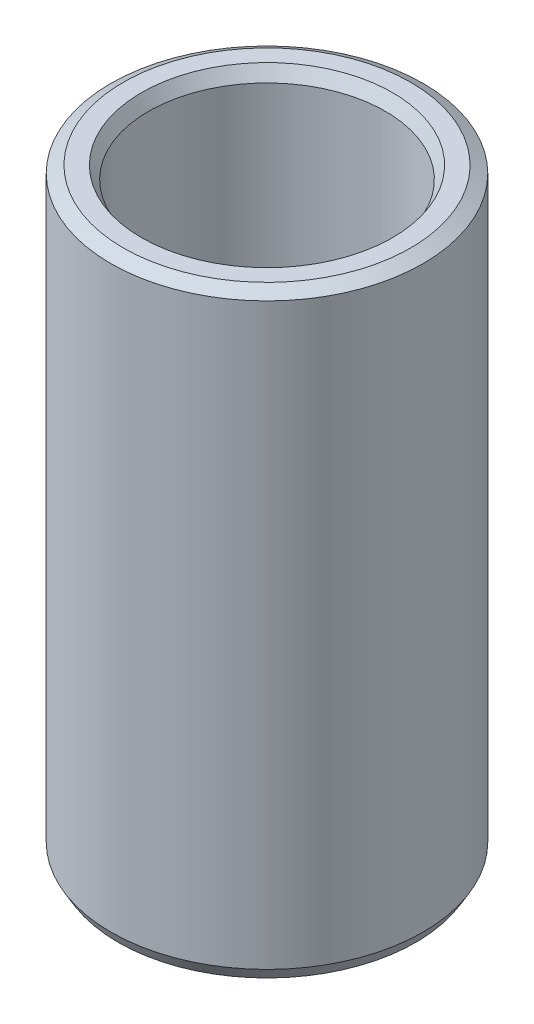
from build123d import *
from OCP.BRepFilletAPI import BRepFilletAPI_MakeChamfer

# Parameters (mm, degrees)
SKETCH1_R           = 12.5
BOSS_EXTRUDE1_DEPTH = 47.932570615
SKETCH2_R           = 9.47765929
CUT_EXTRUDE1_DEPTH  = 52.088465682
CHAMFER1_SIZE       = 0.579074246
CHAMFER1_SIZE2      = 1.002986016


with BuildPart() as part:
    # Sketch1 → Boss-Extrude1 (new body)
    with BuildSketch(Plane(origin=(0, 0, 0), x_dir=(1, 0, 0), z_dir=(0, 1, 0))):
        Circle(SKETCH1_R)
    extrude(amount=BOSS_EXTRUDE1_DEPTH)

    # Sketch2 → Cut-Extrude1 (cut, through all)
    with BuildSketch(Plane(origin=(0, 0, 0), x_dir=(1, 0, 0), z_dir=(0, 1, 0))):
        Circle(SKETCH2_R)
    extrude(amount=CUT_EXTRUDE1_DEPTH, mode=Mode.SUBTRACT)

    # Chamfer1: one chamfer whose edges measure the first distance from different faces: ONE call of the kernel's chamfer builder (chamfer() names one face for all edges)
    chamfer1_edges_1 = [part.edges().sort_by_distance(p)[0] for p in [
        (-9.47765929, 47.932570615, 0),
    ]]
    chamfer1_side_1 = [part.faces().sort_by_distance(p)[0] for p in [
        (-12.146446609, 47.932570615, 0),
    ]]
    chamfer1_edges_2 = [part.edges().sort_by_distance(p)[0] for p in [
        (-9.47765929, 0, 0),
    ]]
    chamfer1_side_2 = [part.faces().sort_by_distance(p)[0] for p in [
        (-9.47765929, 23.966285308, 0),
    ]]
    chamfer1_edges_3 = [part.edges().sort_by_distance(p)[0] for p in [
        (-12.5, 0, 0),
    ]]
    chamfer1_side_3 = [part.faces().sort_by_distance(p)[0] for p in [
        (-12.146446609, 0, 0),
    ]]
    chamfer1_edges_4 = [part.edges().sort_by_distance(p)[0] for p in [
        (-12.5, 47.932570615, 0),
    ]]
    chamfer1_side_4 = [part.faces().sort_by_distance(p)[0] for p in [
        (-12.5, 23.966285308, 0),
    ]]
    chamfer1 = BRepFilletAPI_MakeChamfer(part.part.solid().wrapped)
    for e in chamfer1_edges_1:
        chamfer1.Add(CHAMFER1_SIZE, CHAMFER1_SIZE2, e.wrapped, chamfer1_side_1[0].wrapped)  # the first distance lies on this face
    for e in chamfer1_edges_2:
        chamfer1.Add(CHAMFER1_SIZE, CHAMFER1_SIZE2, e.wrapped, chamfer1_side_2[0].wrapped)  # the first distance lies on this face
    for e in chamfer1_edges_3:
        chamfer1.Add(CHAMFER1_SIZE, CHAMFER1_SIZE2, e.wrapped, chamfer1_side_3[0].wrapped)  # the first distance lies on this face
    for e in chamfer1_edges_4:
        chamfer1.Add(CHAMFER1_SIZE, CHAMFER1_SIZE2, e.wrapped, chamfer1_side_4[0].wrapped)  # the first distance lies on this face
    add(Compound.cast(chamfer1.Shape()), mode=Mode.REPLACE)


solid = part.part
